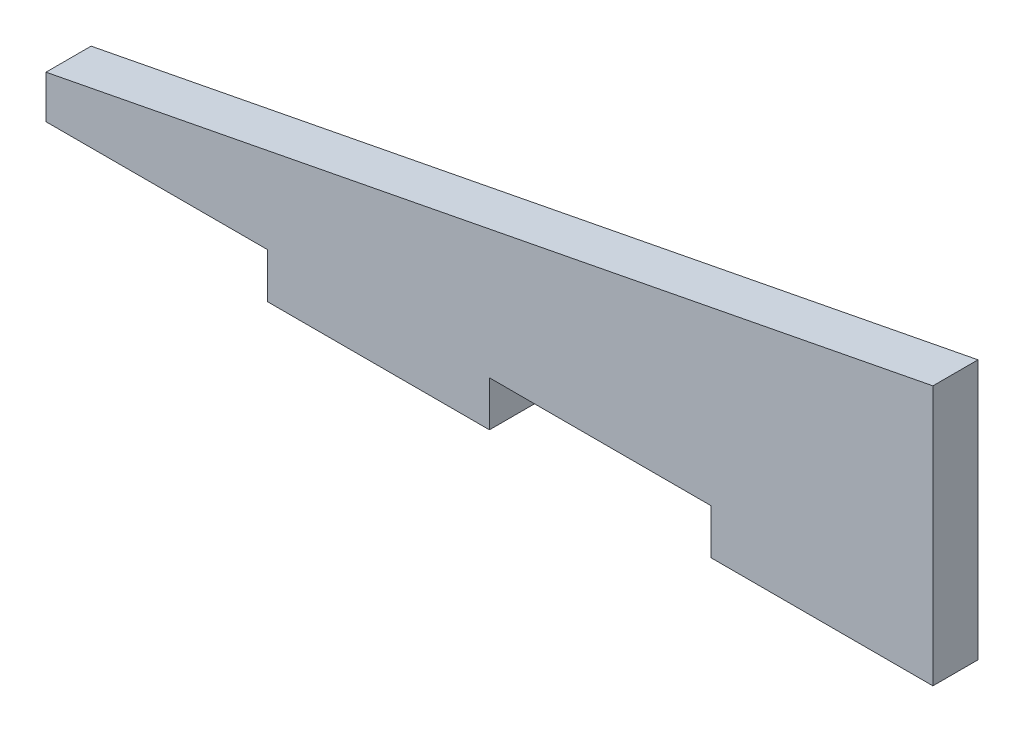
from build123d import *

# Parameters (mm, degrees)
SKETCH1_W           = 104.902
SKETCH1_H           = 30.734
BOSS_EXTRUDE1_DEPTH = 5.334
SKETCH2_W           = 26.2255
SKETCH2_H           = 5.334
CUT_EXTRUDE1_DEPTH  = 62.23369393
CUT_EXTRUDE4_DEPTH  = 62.23369393


with BuildPart() as part:
    # Sketch1 → Boss-Extrude1 (new body)
    with BuildSketch(Plane.XY):
        with Locations((-4.604300362, 6.215548898)):
            Rectangle(SKETCH1_W, SKETCH1_H)
    extrude(amount=BOSS_EXTRUDE1_DEPTH)

    # Sketch2 → Cut-Extrude1 (cut, through all)
    with BuildSketch(Plane.XY.offset(5.334)):
        with Locations((-43.942550362, -6.484451102)):
            Rectangle(SKETCH2_W, SKETCH2_H)
        with Locations((8.508449638, -6.484451102)):
            Rectangle(SKETCH2_W, SKETCH2_H)
    extrude(amount=-CUT_EXTRUDE1_DEPTH, mode=Mode.SUBTRACT)

    # Sketch5 → Cut-Extrude4 (cut, through all)
    with BuildSketch(Plane.XY.offset(5.334)):
        Polygon((-57.055300362, 1.262548898), (47.846699638, 21.582548898), (47.846699638, 53.214808456), (-57.055300362, 40.514808456), align=None)
    extrude(amount=-CUT_EXTRUDE4_DEPTH, mode=Mode.SUBTRACT)


solid = part.part
